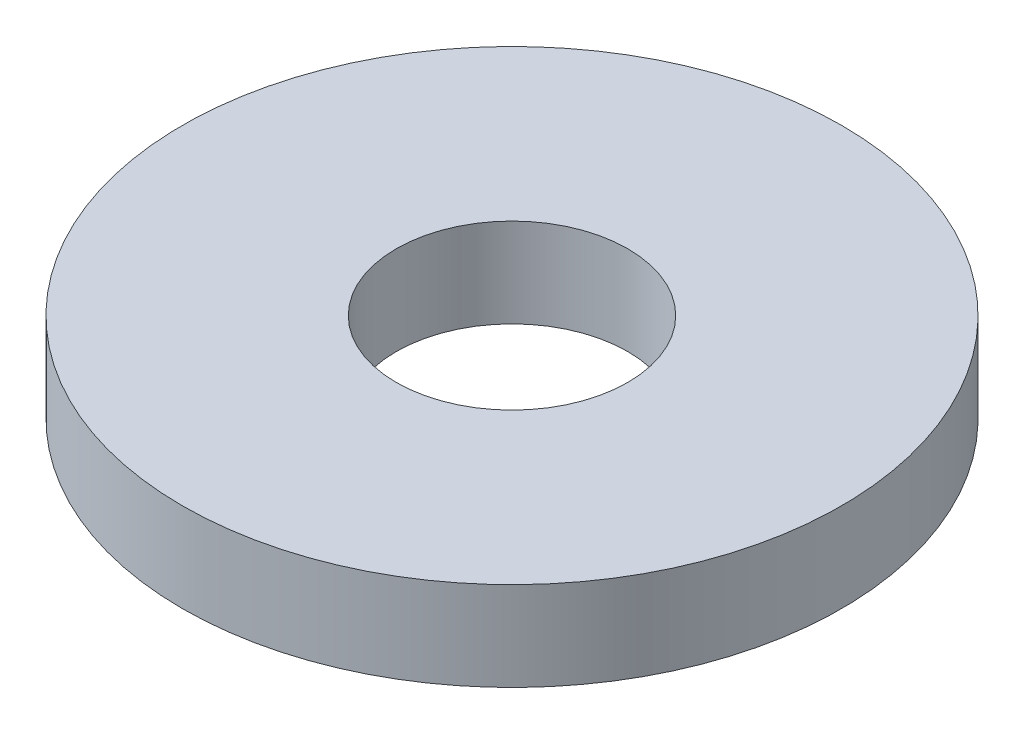
from build123d import *

# Parameters (mm, degrees)
SKETCH1_R           = 92.5
BOSS_EXTRUDE1_DEPTH = 25
SKETCH2_R           = 32.5
CUT_EXTRUDE1_DEPTH  = 134.182206019


with BuildPart() as part:
    # Sketch1 → Boss-Extrude1 (new body)
    with BuildSketch(Plane(origin=(0, 0, 0), x_dir=(1, 0, 0), z_dir=(0, 1, 0))):
        Circle(SKETCH1_R)
    extrude(amount=BOSS_EXTRUDE1_DEPTH)

    # Sketch2 → Cut-Extrude1 (cut, through all)
    with BuildSketch(Plane(origin=(0, 0, 0), x_dir=(1, 0, 0), z_dir=(0, 1, 0))):
        Circle(SKETCH2_R)
    extrude(amount=CUT_EXTRUDE1_DEPTH, mode=Mode.SUBTRACT)


solid = part.part
